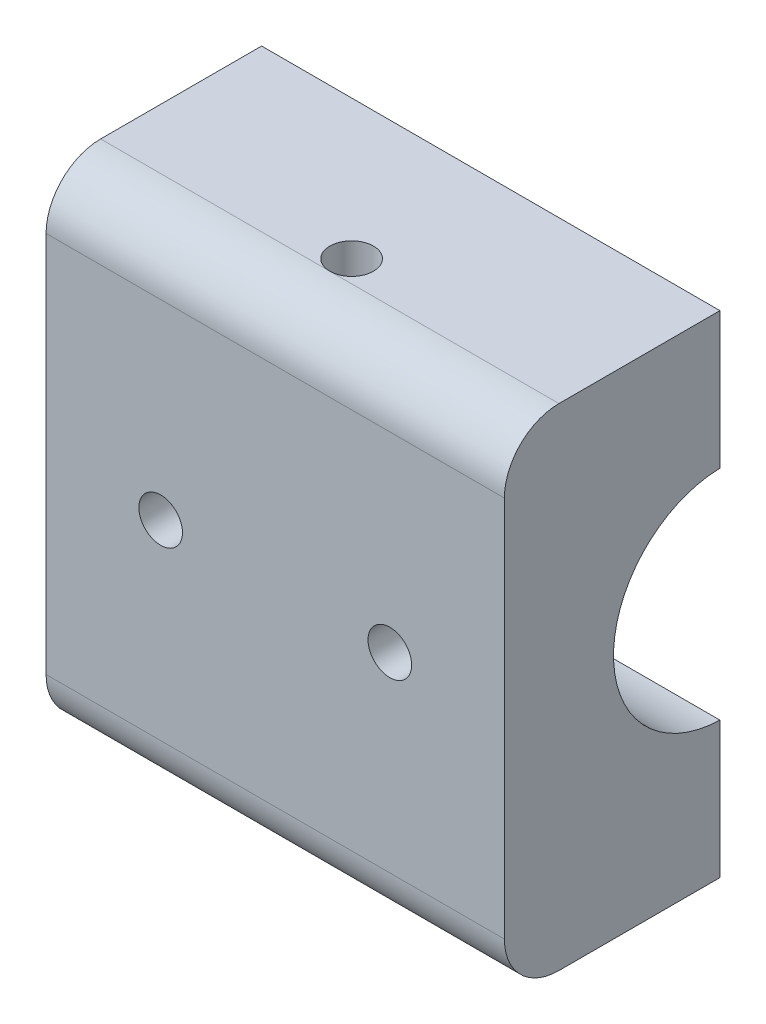
from build123d import *

# Parameters (mm, degrees)
BOSS_EXTRUDE1_DEPTH = 42
SKETCH4_R           = 2
CUT_EXTRUDE4_DEPTH  = 52.578217301
SKETCH5_R           = 2
CUT_EXTRUDE5_DEPTH  = 65.722484597


with BuildPart() as part:
    # Sketch1 → Boss-Extrude1 (new body)
    with BuildSketch(Plane(origin=(0, 0, 0), x_dir=(0, 0, -1), z_dir=(1, 0, 0))):
        with BuildLine():
            Line((-0.25, 9.996874512), (-0.25, 22.5))
            Line((-0.25, 22.5), (-15, 22.5))
            ThreePointArc((-15, 22.5), (-18.535533906, 21.035533906), (-20, 17.5))
            Line((-20, 17.5), (-20, -17.5))
            ThreePointArc((-20, -17.5), (-18.535533906, -21.035533906), (-15, -22.5))
            Line((-15, -22.5), (-0.25, -22.5))
            Line((-0.25, -22.5), (-0.25, -9.996874512))
            ThreePointArc((-0.25, -9.996874512), (-10, 0), (-0.25, 9.996874512))
        make_face()
    extrude(amount=-BOSS_EXTRUDE1_DEPTH)

    # Sketch4 → Cut-Extrude4 (cut, through all)
    with BuildSketch(Plane.XY.offset(20)):
        with Locations((-10.5, 0)):
            Circle(SKETCH4_R)
        with Locations((-31.5, 0)):
            Circle(SKETCH4_R)
    extrude(amount=-CUT_EXTRUDE4_DEPTH, mode=Mode.SUBTRACT)

    # Sketch5 → Cut-Extrude5 (cut, through all)
    with BuildSketch(Plane.XZ.offset(22.5)):
        with Locations((-21, 13)):
            Circle(SKETCH5_R)
    extrude(amount=-CUT_EXTRUDE5_DEPTH, mode=Mode.SUBTRACT)


solid = part.part
